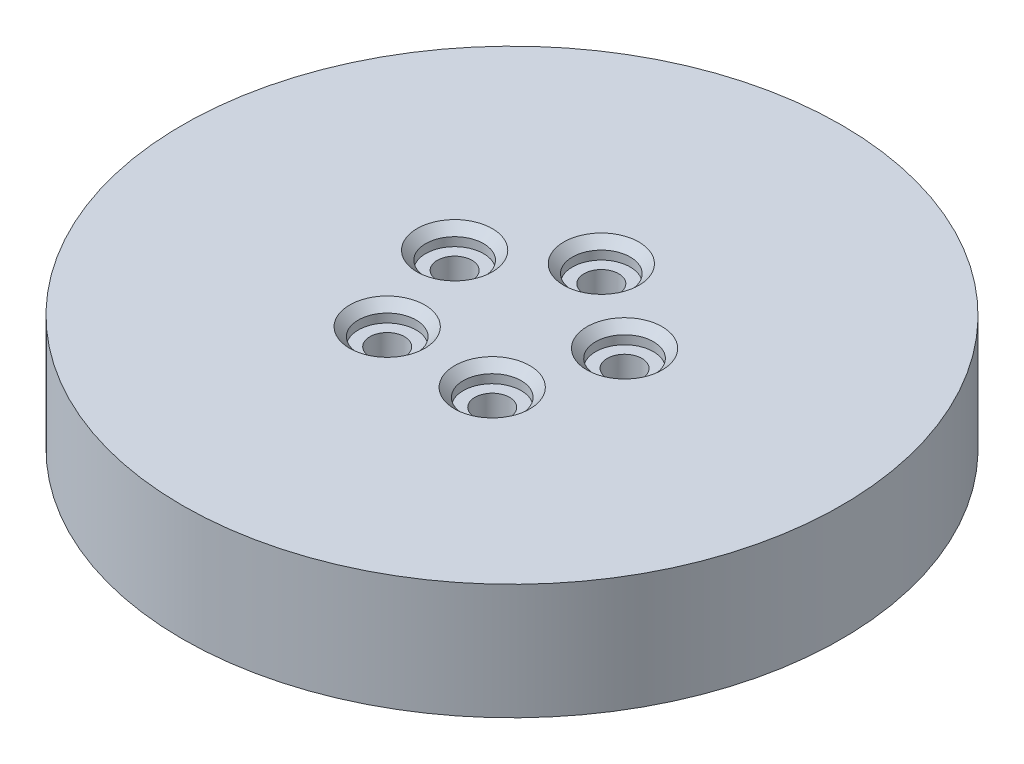
from build123d import *

# Parameters (mm, degrees)
SKETCH1_R           = 114
BOSS_EXTRUDE1_DEPTH = 40
SKETCH2_R           = 6
CUT_EXTRUDE1_DEPTH  = 40
SKETCH3_R           = 45
CUT_EXTRUDE2_DEPTH  = 15
SKETCH4_R           = 10
CUT_EXTRUDE3_DEPTH  = 6
CHAMFER1_SIZE       = 3


with BuildPart() as part:
    # Sketch1 → Boss-Extrude1 (new body)
    with BuildSketch(Plane(origin=(0, 0, 0), x_dir=(1, 0, 0), z_dir=(0, 1, 0))):
        Circle(SKETCH1_R)
    extrude(amount=BOSS_EXTRUDE1_DEPTH)

    # Sketch2 → Cut-Extrude1 (cut)
    with BuildSketch(Plane(origin=(0, 40, 0), x_dir=(1, 0, 0), z_dir=(0, 1, 0))):
        with Locations((0, 30.901699437)):
            Circle(SKETCH2_R)
        with Locations((-29.389262615, 9.549150281)):
            Circle(SKETCH2_R)
        with Locations((29.389262615, 9.549150281)):
            Circle(SKETCH2_R)
        with Locations((-18.1635632, -25)):
            Circle(SKETCH2_R)
        with Locations((18.1635632, -25)):
            Circle(SKETCH2_R)
    extrude(amount=-CUT_EXTRUDE1_DEPTH, mode=Mode.SUBTRACT)

    # Sketch3 → Cut-Extrude2 (cut)
    with BuildSketch(Plane.XZ):
        Circle(SKETCH3_R)
    extrude(amount=-CUT_EXTRUDE2_DEPTH, mode=Mode.SUBTRACT)

    # Sketch4 → Cut-Extrude3 (cut)
    with BuildSketch(Plane(origin=(0, 40, 0), x_dir=(1, 0, 0), z_dir=(0, 1, 0))):
        with Locations((0, 30.901699437)):
            Circle(SKETCH4_R)
        with Locations((-29.389262615, 9.549150281)):
            Circle(SKETCH4_R)
        with Locations((-18.1635632, -25)):
            Circle(SKETCH4_R)
        with Locations((18.1635632, -25)):
            Circle(SKETCH4_R)
        with Locations((29.389262615, 9.549150281)):
            Circle(SKETCH4_R)
    extrude(amount=-CUT_EXTRUDE3_DEPTH, mode=Mode.SUBTRACT)

    # Chamfer1
    chamfer1_edges = [part.edges().sort_by_distance(p)[0] for p in [
        (-28.1635632, 40, 25),
        (8.1635632, 40, 25),
        (19.389262615, 40, -9.549150281),
        (-39.389262615, 40, -9.549150281),
        (-10, 40, -30.901699437),
    ]]
    chamfer(chamfer1_edges, length=CHAMFER1_SIZE)


solid = part.part
